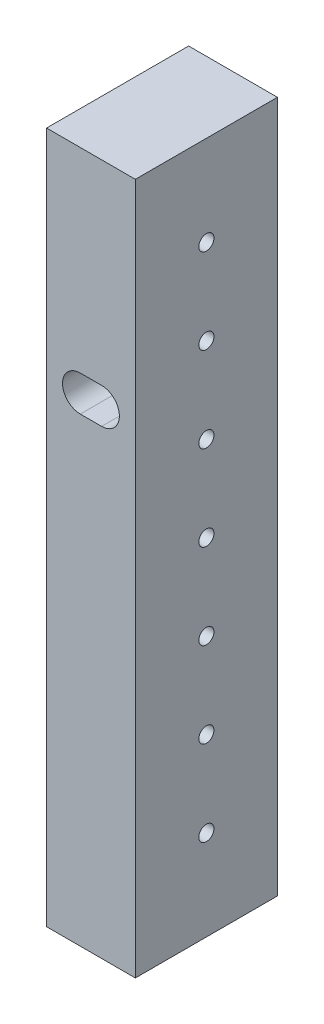
from build123d import *

# Parameters (mm, degrees)
SKETCH1_W                           = 15.875
SKETCH1_H                           = 25.4
BOSS_EXTRUDE1_DEPTH                 = 123.6726
TAP_DRILL_FOR_10_24_TAP1_D          = 3.7973
TAP_DRILL_FOR_10_24_TAP1_DEPTH      = 20.701
TAP_DRILL_FOR_10_24_TAP1_TIP        = 1.140824014
TAP_DRILL_FOR_6_32_TAP1_D           = 2.7051
TAP_START                           = -25.4
TAP_DRILL_SLOT_FOR_10_24_TAP1_DEPTH = 25.4
TAP_DRILL_SLOT_FOR_10_24_TAP2_D     = 6.35


# Read off the part's stored shape, not the designer's step: Tap Drill Slot for #10-24 Tap1
with BuildPart() as part:
    # Sketch1 → Boss-Extrude1 (new body)
    with BuildSketch(Plane(origin=(0, 0, 0), x_dir=(1, 0, 0), z_dir=(0, 1, 0))):
        with Locations((7.9375, 12.7)):
            Rectangle(SKETCH1_W, SKETCH1_H)
    extrude(amount=BOSS_EXTRUDE1_DEPTH)

    # Tap Drill for #10-24 Tap1
    with Locations(Plane(origin=(0, 0, 0), x_dir=(-1, 0, 0), z_dir=(0, -1, 0))):
        with Locations((-7.9375, 6), (-7.9375, 19.4)):
            Hole(TAP_DRILL_FOR_10_24_TAP1_D / 2, depth=TAP_DRILL_FOR_10_24_TAP1_DEPTH)
            with Locations((0, 0, -(TAP_DRILL_FOR_10_24_TAP1_DEPTH + TAP_DRILL_FOR_10_24_TAP1_TIP / 2))):  # 118° drill point
                Cone(0, TAP_DRILL_FOR_10_24_TAP1_D / 2, TAP_DRILL_FOR_10_24_TAP1_TIP, mode=Mode.SUBTRACT)

    # Tap Drill for #6-32 Tap1 (through all)
    with Locations(Plane.ZY):
        with Locations((-12.7, 61.8363), (-12.7, 77.0763), (-12.7, 92.3163), (-12.7, 46.5963), (-12.7, 31.3563), (-12.7, 107.5563), (-12.7, 16.1163)):
            Hole(TAP_DRILL_FOR_6_32_TAP1_D / 2)

    # Tap Drill Slot for #10-24 Tap1 outline → Tap Drill Slot for #10-24 Tap1 (cut)
    with BuildSketch(Plane.XY.offset(TAP_START)):
        with BuildLine():
            Line((6.029499774, 82.3976), (9.839499774, 82.3976))
            ThreePointArc((9.839499774, 82.3976), (13.014499774, 85.5726), (9.839499774, 88.7476))
            Line((9.839499774, 88.7476), (6.029499774, 88.7476))
            ThreePointArc((6.029499774, 88.7476), (2.854499774, 85.5726), (6.029499774, 82.3976))
        make_face()
    extrude(amount=TAP_DRILL_SLOT_FOR_10_24_TAP1_DEPTH, mode=Mode.SUBTRACT)

    # Tap Drill Slot for #10-24 Tap2 (through all)
    with Locations(Plane(origin=(-765.990733255, -1637.545835602, 0), x_dir=(1, 0, 0), z_dir=(0, 0, 1))):
        with Locations((773.925233029, 1723.118435602)):
            Hole(TAP_DRILL_SLOT_FOR_10_24_TAP2_D / 2)


solid = part.part
